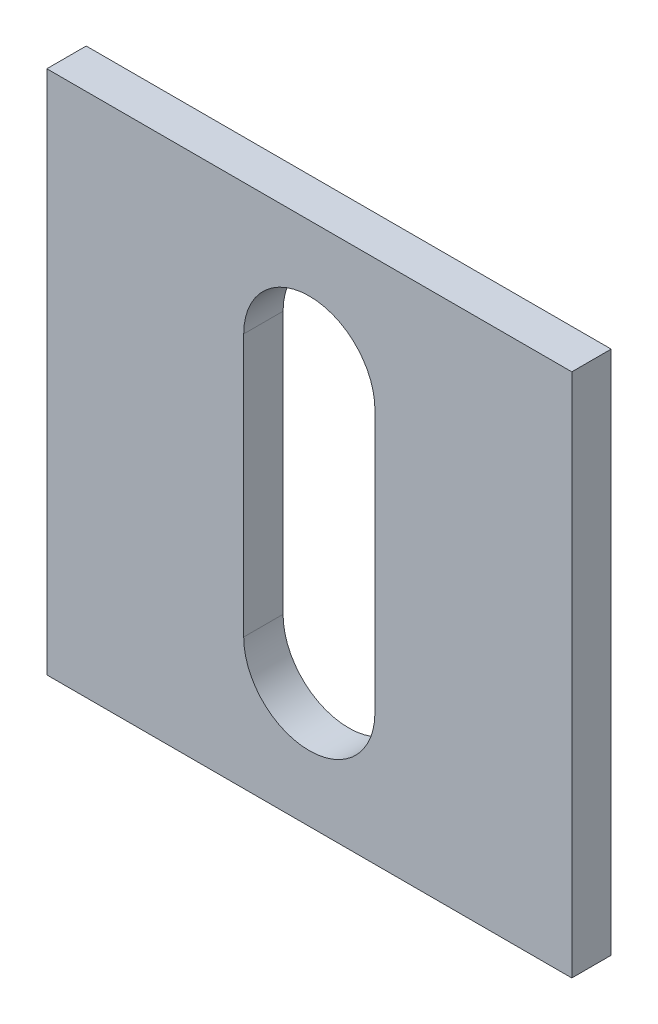
from build123d import *

# Parameters (mm, degrees)
SKETCH1_W           = 40
SKETCH1_H           = 40
BOSS_EXTRUDE1_DEPTH = 3


with BuildPart() as part:
    # Sketch1 → Boss-Extrude1 (new body)
    with BuildSketch(Plane.XY):
        with Locations((20, 20)):
            Rectangle(SKETCH1_W, SKETCH1_H)
        with BuildLine():
            Line((25, 30), (25, 10))
            ThreePointArc((25, 10), (20, 5), (15, 10))
            Line((15, 10), (15, 30))
            ThreePointArc((15, 30), (20, 35), (25, 30))
        make_face(mode=Mode.SUBTRACT)
    extrude(amount=BOSS_EXTRUDE1_DEPTH)


solid = part.part
